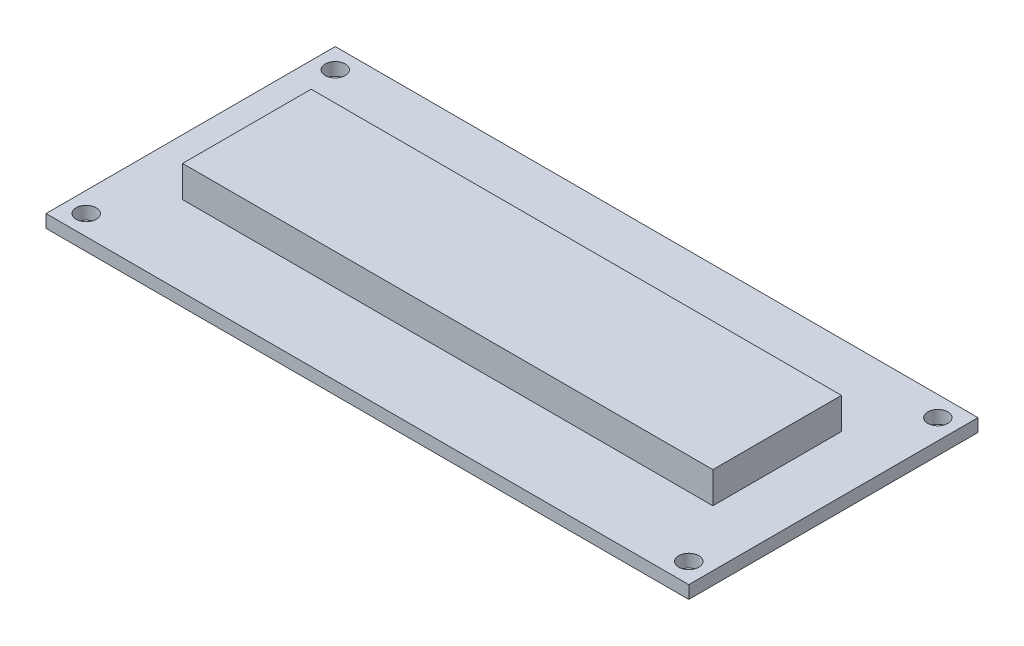
from build123d import *

# Parameters (mm, degrees)
SKETCH1_W               = 80
SKETCH1_H               = 36
BOSS_EXTRUDE1_DEPTH     = 1.6
SKETCH3_W               = 66
SKETCH3_H               = 16
BOSS_EXTRUDE2_DEPTH     = 3.9
SKETCH4_R               = 1.25
CUT_EXTRUDE1_DEPTH      = 4.9
MIRROR3_COPY_1_SKETCH_R = 1.25
MIRROR3_COPY_1_DEPTH    = 4.9


with BuildPart() as part:
    # Sketch1 → Boss-Extrude1 (new body)
    with BuildSketch(Plane(origin=(0, 0, 0), x_dir=(1, 0, 0), z_dir=(0, 1, 0))):
        Rectangle(SKETCH1_W, SKETCH1_H)
    extrude(amount=BOSS_EXTRUDE1_DEPTH)

    # Sketch3 → Boss-Extrude2 (add)
    with BuildSketch(Plane(origin=(0, 1.6, 0), x_dir=(1, 0, 0), z_dir=(0, 1, 0))):
        Rectangle(SKETCH3_W, SKETCH3_H)
    extrude(amount=BOSS_EXTRUDE2_DEPTH)

    # Sketch4 → Cut-Extrude1 (cut)
    with BuildSketch(Plane(origin=(0, 1.6, 0), x_dir=(1, 0, 0), z_dir=(0, 1, 0))):
        with Locations((-37.5, 15.5)):
            Circle(SKETCH4_R)
    cut_extrude1 = extrude(amount=-CUT_EXTRUDE1_DEPTH, mode=Mode.SUBTRACT)

    # Mirror2: Cut-Extrude1 across plane
    add(cut_extrude1.mirror(Plane.ZY), mode=Mode.SUBTRACT)

    # Mirror3: Cut-Extrude1 across plane
    add(cut_extrude1.mirror(Plane.XY), mode=Mode.SUBTRACT)

    # Mirror3 copy 1 sketch → Mirror3 copy 1 (cut)
    with BuildSketch(Plane(origin=(0, 1.6, 0), x_dir=(-1, 0, 0), z_dir=(0, 1, 0))):
        with Locations((-37.5, 15.5)):
            Circle(MIRROR3_COPY_1_SKETCH_R)
    extrude(amount=-MIRROR3_COPY_1_DEPTH, mode=Mode.SUBTRACT)


solid = part.part
